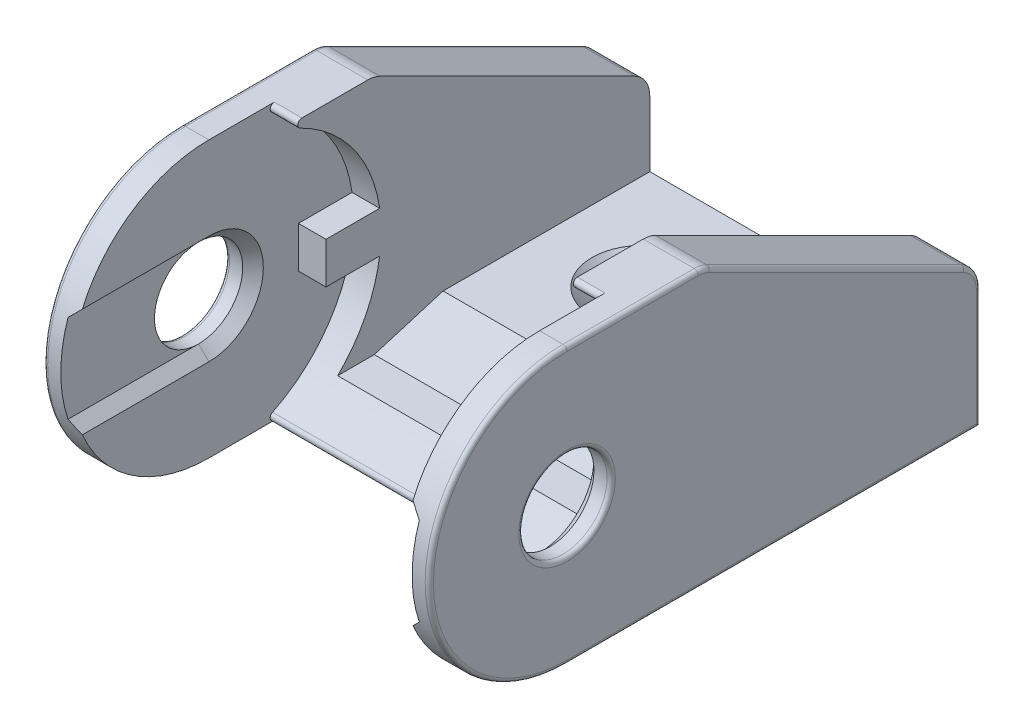
from build123d import *

# Parameters (mm, degrees)
BOSS_EXTRUDE1_DEPTH = 14
SKETCH2_R           = 3.2
CUT_EXTRUDE1_DEPTH  = 48
CUT_EXTRUDE2_DEPTH  = 10
CUT_EXTRUDE4_DEPTH  = 12
FILLET1_R           = 0.3
CUT_EXTRUDE3_DEPTH  = 4
CHAMFER1_SIZE       = 2
FILLET2_R           = 2
FILLET3_R           = 0.3
SKETCH7_W           = 25.5
SKETCH7_H           = 10
CUT_EXTRUDE5_DEPTH  = 3.2
CHAMFER2_SIZE       = 0.75


with BuildPart() as part:
    # Sketch1 → Boss-Extrude1 (new, symmetric)
    with BuildSketch(Plane(origin=(0, 0, 0), x_dir=(0, 0, -1), z_dir=(1, 0, 0))):
        with BuildLine():
            Line((30, -10), (0, -10))
            ThreePointArc((0, -10), (-10, 0), (0, 10))
            Line((0, 10), (30, 10))
            Line((30, 10), (30, -10))
        make_face()
    extrude(amount=BOSS_EXTRUDE1_DEPTH, both=True)

    # Sketch2 → Cut-Extrude1 (cut)
    with BuildSketch(Plane(origin=(14, 0, 0), x_dir=(0, 0, -1), z_dir=(1, 0, 0))):
        Circle(SKETCH2_R)
        Polygon((30, 0), (10, 10), (30, 10), align=None)
    extrude(amount=-CUT_EXTRUDE1_DEPTH, mode=Mode.SUBTRACT)

    # Sketch4 → Cut-Extrude2 (cut, symmetric)
    with BuildSketch(Plane(origin=(0, 0, 0), x_dir=(0, 0, -1), z_dir=(1, 0, 0))):
        with BuildLine():
            Line((0, -10), (1.5, -10))
            Line((1.5, -10), (1.5, -7.5))
            Line((1.5, -7.5), (10, -7.5))
            Line((10, -7.5), (15, -6))
            Line((15, -6), (30, -6))
            Line((30, -6), (30, 0))
            Line((30, 0), (10, 10))
            Line((10, 10), (0, 10))
            ThreePointArc((0, 10), (-10, 0), (0, -10))
        make_face()
    extrude(amount=CUT_EXTRUDE2_DEPTH, both=True, mode=Mode.SUBTRACT)

    # Sketch6 → Cut-Extrude4 (cut, symmetric)
    with BuildSketch(Plane(origin=(0, 0, 0), x_dir=(0, 0, -1), z_dir=(1, 0, 0))):
        with BuildLine():
            Line((10.392304845, 1.5), (6.5, 1.5))
            Line((6.5, 1.5), (6.5, -1.5))
            Line((6.5, -1.5), (10.392304845, -1.5))
            ThreePointArc((10.392304845, -1.5), (-10.5, 0), (10.392304845, 1.5))
        make_face()
    extrude(amount=CUT_EXTRUDE4_DEPTH, both=True, mode=Mode.SUBTRACT)

    # Fillet1
    fillet1_edges = [part.edges().sort_by_distance(p)[0] for p in [
        (0, -10, -3.201562119),
        (-11, 10, -3.201562119),
        (11, 10, -3.201562119),
    ]]
    fillet(fillet1_edges, radius=FILLET1_R)

    # Sketch5 → Cut-Extrude3 (cut)
    with BuildSketch(Plane(origin=(0, -10, 0), x_dir=(1, 0, 0), z_dir=(0, 1, 0))):
        with BuildLine():
            Line((-3, 24.2), (3, 24.2))
            ThreePointArc((3, 24.2), (4.7, 22.5), (3, 20.8))
            Line((3, 20.8), (-3, 20.8))
            ThreePointArc((-3, 20.8), (-4.7, 22.5), (-3, 24.2))
        make_face()
    extrude(amount=CUT_EXTRUDE3_DEPTH, mode=Mode.SUBTRACT)

    # Chamfer1
    chamfer1_edges = [part.edges().sort_by_distance(p)[0] for p in [
        (0, -6, -24.2),
        (4.7, -6, -22.5),
        (0, -6, -20.8),
        (-4.7, -6, -22.5),
    ]]
    chamfer(chamfer1_edges, length=CHAMFER1_SIZE)

    # Fillet2
    fillet2_edges = [part.edges().sort_by_distance(p)[0] for p in [
        (-12, 0, -30),
        (-12, 10, -10),
        (12, 10, -10),
        (12, 0, -30),
    ]]
    fillet(fillet2_edges, radius=FILLET2_R)

    # Fillet3
    fillet3_edges = [part.edges().sort_by_distance(p)[0] for p in [
        (14, -5.618033989, -30),
        (-14, 5.170820393, -19.658359214),
        (-14, 10, -4.763932023),
        (-14, -0.184605753, -29.701301617),
        (-14, 9.946497979, -9.987369886),
        (14, 5.170820393, -19.658359214),
        (14, 10, -4.763932023),
        (14, -0.184605753, -29.701301617),
        (14, 9.946497979, -9.987369886),
        (-14, 0, 3.2),
        (14, 0, 3.2),
        (14, 0, 10),
        (-14, -5.618033989, -30),
        (-14, -10, -15),
        (-14, 0, 10),
        (14, -10, -15),
    ]]
    fillet(fillet3_edges, radius=FILLET3_R)

    # Sketch7 → Cut-Extrude5 (cut, symmetric)
    with BuildSketch(Plane(origin=(0, 0, 0), x_dir=(1, 0, 0), z_dir=(0, 1, 0))):
        with Locations((0, -5)):
            Rectangle(SKETCH7_W, SKETCH7_H)
    extrude(amount=CUT_EXTRUDE5_DEPTH, both=True, mode=Mode.SUBTRACT)

    # Chamfer2
    chamfer2_edges = [part.edges().sort_by_distance(p)[0] for p in [
        (12, 3.2, 4.737087713),
        (12, -3.2, 4.737087713),
        (12, -2.2627417, -2.2627417),
        (-12, 3.2, 4.737087713),
        (-12, -3.2, 4.737087713),
        (-12, 2.2627417, -2.2627417),
    ]]
    chamfer(chamfer2_edges, length=CHAMFER2_SIZE - 0.0001)  # a hair under: the kernel refuses the full size


solid = part.part
